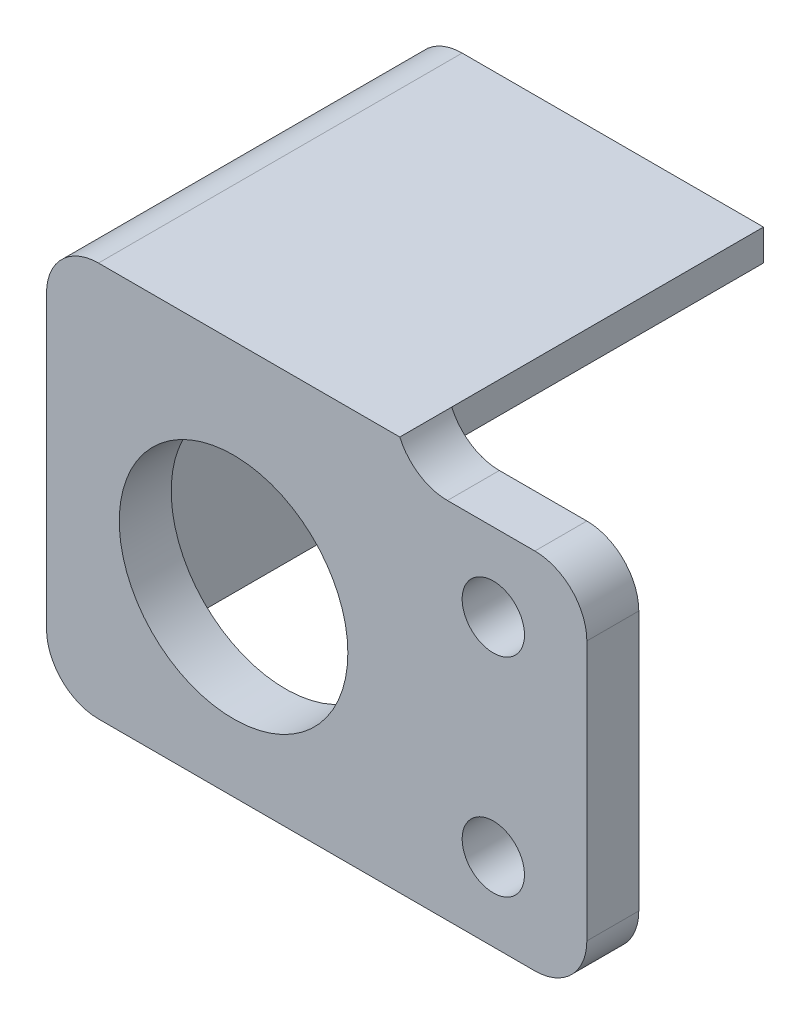
from build123d import *

# Parameters (mm, degrees)
SKETCH1_W           = 50
SKETCH1_H           = 35
SKETCH1_R           = 11
SKETCH1_R_2         = 3
BOSS_EXTRUDE1_DEPTH = 5
SKETCH2_W           = 32
SKETCH2_H           = 30
SKETCH2_H_2         = 5
BOSS_EXTRUDE2_DEPTH = 3
SKETCH3_W           = 35
SKETCH3_H           = 38
BOSS_EXTRUDE3_DEPTH = 2
FILLET1_R           = 5


with BuildPart() as part:
    # Sketch1 → Boss-Extrude1 (new body)
    with BuildSketch(Plane.XY):
        Rectangle(SKETCH1_W, SKETCH1_H)
        with Locations((-9, 0)):
            Circle(SKETCH1_R, mode=Mode.SUBTRACT)
        with Locations(Location((16, -10, 0), (0, 0, 180))):
            Circle(SKETCH1_R_2, mode=Mode.SUBTRACT)
        with Locations((16, 10)):
            Circle(SKETCH1_R_2, mode=Mode.SUBTRACT)
    extrude(amount=BOSS_EXTRUDE1_DEPTH)

    # Sketch2 → Boss-Extrude2 (add)
    with BuildSketch(Plane(origin=(0, 17.5, 0), x_dir=(1, 0, 0), z_dir=(0, 1, 0))):
        with Locations((-9, 15)):
            Rectangle(SKETCH2_W, SKETCH2_H)
        with Locations((-9, -2.5)):
            Rectangle(SKETCH2_W, SKETCH2_H_2)
    extrude(amount=BOSS_EXTRUDE2_DEPTH)

    # Sketch3 → Boss-Extrude3 (add)
    with BuildSketch(Plane.ZY.offset(25)):
        with Locations((-12.5, 1.5)):
            Rectangle(SKETCH3_W, SKETCH3_H)
    extrude(amount=BOSS_EXTRUDE3_DEPTH)

    # Fillet1
    # the kernel refuses this fillet: 5 mm, written as the material it adds along each edge
    with BuildSketch(Plane(origin=(7, 17.5, 5), x_dir=(1, 0, 0), z_dir=(0, 0, -1))) as fillet1_piece_1:
        with BuildLine():
            CenterArc((4.582575695, -5), FILLET1_R, 90, 66.421821522)
            Line((0, -3), (0, 0))
            Line((0, 0), (4.582575695, 0))
        make_face()
    extrude(amount=5)
    with BuildSketch(Plane(origin=(-25, 17.5, -30), x_dir=(0, -1, 0), z_dir=(0, 0, 1))) as fillet1_piece_2:
        with BuildLine():
            CenterArc((FILLET1_R, FILLET1_R), FILLET1_R, 180, 90)
            Line((0, FILLET1_R), (0, 0))
            Line((0, 0), (FILLET1_R, 0))
        make_face()
    extrude(amount=30)
    # the kernel refuses this fillet: 5 mm, written as the material it takes off along each edge
    with BuildSketch(Plane(origin=(25, 17.5, -12.5), x_dir=(-1, 0, 0), z_dir=(0, 0, 1)), Plane(origin=(25, -17.5, -12.5), x_dir=(0, 1, 0), z_dir=(0, 0, 1))) as fillet1_2_piece_1:
        with BuildLine():
            CenterArc((FILLET1_R, FILLET1_R), FILLET1_R, 180, 90)
            Line((0, FILLET1_R), (0, 0))
            Line((0, 0), (FILLET1_R, 0))
        make_face()
    extrude(amount=30, mode=Mode.SUBTRACT)
    with BuildSketch(Plane(origin=(-27, -17.5, -42.5), x_dir=(1, 0, 0), z_dir=(0, 0, 1))) as fillet1_2_piece_2:
        with BuildLine():
            CenterArc((FILLET1_R, FILLET1_R), FILLET1_R, 180, 90)
            Line((0, FILLET1_R), (0, 0))
            Line((0, 0), (FILLET1_R, 0))
        make_face()
    extrude(amount=60, mode=Mode.SUBTRACT)
    with BuildSketch(Plane(origin=(-27, 20.5, 17.5), x_dir=(0, -1, 0), z_dir=(0, 0, -1))) as fillet1_2_piece_3:
        with BuildLine():
            CenterArc((FILLET1_R, -FILLET1_R), FILLET1_R, 90, 90)
            Line((0, -FILLET1_R), (0, 0))
            Line((0, 0), (FILLET1_R, 0))
        make_face()
    extrude(amount=60, mode=Mode.SUBTRACT)


solid = part.part
